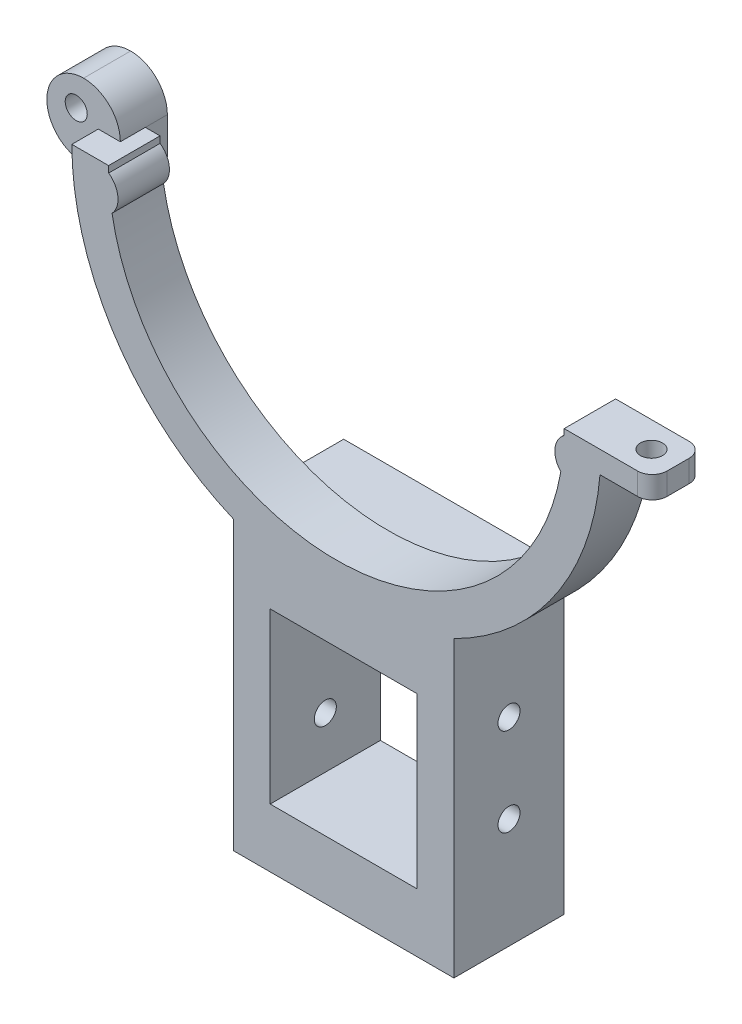
from build123d import *

# Parameters (mm, degrees)
BOSS_EXTRUDE2_DEPTH      = 7
BOSS_EXTRUDE4_DEPTH      = 3
BOSS_EXTRUDE4_DEPTH_BACK = 3.4
SKETCH2_W                = 10
SKETCH2_H                = 10
SKETCH3_R                = 1.5
CUT_EXTRUDE1_DEPTH       = 10
SKETCH4_W                = 8
SKETCH4_H                = 3
BOSS_EXTRUDE5_DEPTH      = 7
SKETCH5_R                = 1.5
CUT_EXTRUDE2_DEPTH       = 7
FILLET1_R                = 5
FILLET2_R                = 5
FILLET3_R                = 5
FILLET4_R                = 2
FILLET5_R                = 2
SKETCH6_W                = 30
SKETCH6_H                = 41
BOSS_EXTRUDE6_DEPTH      = 8
SKETCH7_W                = 20
SKETCH7_H                = 23
CUT_EXTRUDE3_DEPTH       = 24
SKETCH8_R                = 1.5
CUT_EXTRUDE5_DEPTH       = 54


with BuildPart() as part:
    # Sketch1 → Boss-Extrude2 (new body)
    with BuildSketch(Plane.XY):
        with BuildLine():
            Line((36, 0), (31, 0))
            ThreePointArc((31, 0), (30.997217748, -0.415321451), (30.98887149, -0.830568352))
            ThreePointArc((30.98887149, -0.830568352), (29.746163614, -2.974229152), (30.539836631, -5.321501534))
            ThreePointArc((30.539836631, -5.321501534), (0.032857513, -30.999982587), (-30.528487289, -5.386229095))
            ThreePointArc((-30.528487289, -5.386229095), (-29.731741507, -3.029439038), (-30.987456583, -0.881779181))
            ThreePointArc((-30.987456583, -0.881779181), (-30.996863987, -0.440934196), (-31, 0))
            Line((-31, 0), (-36, 0))
            ThreePointArc((-36, 0), (-30.002092566, -19.89659372), (-14.006975463, -33.163302586))
            Line((-14.006975463, -33.163302586), (-14.006975463, -72.252490852))
            Line((-14.006975463, -72.252490852), (15.993024537, -72.252490852))
            Line((15.993024537, -72.252490852), (15.993024537, -32.252490852))
            ThreePointArc((15.993024537, -32.252490852), (30.592065012, -18.976974425), (36, 0))
        make_face()
    extrude(amount=BOSS_EXTRUDE2_DEPTH)

    # Sketch2 → Boss-Extrude4 (add, two sides: drawn at the far end of the back side and taken through both)
    with BuildSketch(Plane(origin=(0, 0, 0), x_dir=(-1, 0, 0), z_dir=(0, 0, -1)).offset(-BOSS_EXTRUDE4_DEPTH_BACK)):
        with Locations((38, 0)):
            Rectangle(SKETCH2_W, SKETCH2_H)
    extrude(amount=BOSS_EXTRUDE4_DEPTH + BOSS_EXTRUDE4_DEPTH_BACK)

    # Sketch3 → Cut-Extrude1 (cut)
    with BuildSketch(Plane.XY.offset(3.4)):
        with Locations((-39, 1)):
            Circle(SKETCH3_R)
    extrude(amount=-CUT_EXTRUDE1_DEPTH, mode=Mode.SUBTRACT)

    # Sketch4 → Boss-Extrude5 (add)
    with BuildSketch(Plane(origin=(0, 0, 0), x_dir=(-1, 0, 0), z_dir=(0, 0, -1))):
        with Locations((-39, -1.5)):
            Rectangle(SKETCH4_W, SKETCH4_H)
    extrude(amount=-BOSS_EXTRUDE5_DEPTH)

    # Sketch5 → Cut-Extrude2 (cut)
    with BuildSketch(Plane.XZ.offset(3)):
        with Locations((39.374782229, 3.5)):
            Circle(SKETCH5_R)
    extrude(amount=-CUT_EXTRUDE2_DEPTH, mode=Mode.SUBTRACT)

    # Fillet1
    fillet1_edges = [part.edges().sort_by_distance(p)[0] for p in [
        (-43, -5, 0.2),
    ]]
    fillet(fillet1_edges, radius=FILLET1_R)

    # Fillet2
    fillet2_edges = [part.edges().sort_by_distance(p)[0] for p in [
        (-43, 5, 0.2),
    ]]
    fillet(fillet2_edges, radius=FILLET2_R - 0.0001)  # a hair under: the kernel refuses the full size

    # Fillet3
    fillet3_edges = [part.edges().sort_by_distance(p)[0] for p in [
        (-33, 5, 0.2),
    ]]
    fillet(fillet3_edges, radius=FILLET3_R)

    # Fillet4
    fillet4_edges = [part.edges().sort_by_distance(p)[0] for p in [
        (43, -1.5, 0),
    ]]
    fillet(fillet4_edges, radius=FILLET4_R)

    # Fillet5
    fillet5_edges = [part.edges().sort_by_distance(p)[0] for p in [
        (43, -1.5, 7),
    ]]
    fillet(fillet5_edges, radius=FILLET5_R)

    # Sketch6 → Boss-Extrude6 (add)
    with BuildSketch(Plane(origin=(0, 0, 0), x_dir=(-1, 0, 0), z_dir=(0, 0, -1))):
        with Locations((-0.993024537, -51.752490852)):
            Rectangle(SKETCH6_W, SKETCH6_H)
    extrude(amount=BOSS_EXTRUDE6_DEPTH)

    # Sketch7 → Cut-Extrude3 (cut)
    with BuildSketch(Plane(origin=(0, 0, -8), x_dir=(-1, 0, 0), z_dir=(0, 0, -1))):
        with Locations((-0.993024537, -52.752490852)):
            Rectangle(SKETCH7_W, SKETCH7_H)
    extrude(amount=-CUT_EXTRUDE3_DEPTH, mode=Mode.SUBTRACT)

    # Sketch8 → Cut-Extrude5 (cut)
    with BuildSketch(Plane(origin=(15.993024537, 0, 0), x_dir=(0, 0, -1), z_dir=(1, 0, 0))):
        with Locations(Location((0.5, -45.252490852, 0), (0, 0, 90))):
            Circle(SKETCH8_R)
        with Locations(Location((0.5, -57.252490852, 0), (0, 0, 90))):
            Circle(SKETCH8_R)
    extrude(amount=-CUT_EXTRUDE5_DEPTH, mode=Mode.SUBTRACT)


solid = part.part
